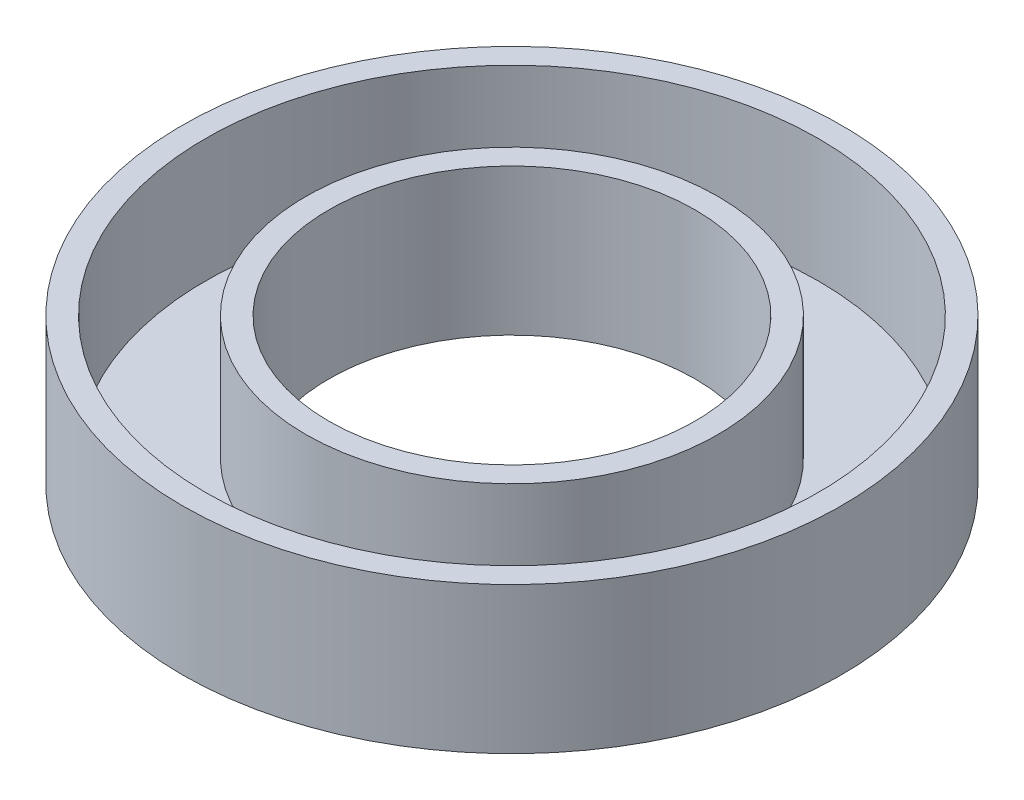
from build123d import *

# Parameters (mm, degrees)
SKETCH1_R            = 14.2875
MAIN_EXTRUSION_DEPTH = 6.35
SKETCH2_R            = 7.9375
ID_BORE_DEPTH        = 20
SKETCH3_R            = 13.2875
SKETCH3_R_2          = 8.9375
SEAL_RECESS_DEPTH    = 5.35


with BuildPart() as part:
    # Sketch1 → main extrusion (new body)
    with BuildSketch(Plane(origin=(0, 0, 0), x_dir=(1, 0, 0), z_dir=(0, 1, 0))):
        Circle(SKETCH1_R)
    extrude(amount=MAIN_EXTRUSION_DEPTH)

    # Sketch2 → ID bore (cut)
    with BuildSketch(Plane(origin=(0, 6.35, 0), x_dir=(1, 0, 0), z_dir=(0, 1, 0))):
        Circle(SKETCH2_R)
    extrude(amount=-ID_BORE_DEPTH, mode=Mode.SUBTRACT)

    # Sketch3 → seal recess (cut)
    with BuildSketch(Plane(origin=(0, 6.35, 0), x_dir=(1, 0, 0), z_dir=(0, 1, 0))):
        Circle(SKETCH3_R)
        Circle(SKETCH3_R_2, mode=Mode.SUBTRACT)
    extrude(amount=-SEAL_RECESS_DEPTH, mode=Mode.SUBTRACT)


solid = part.part
